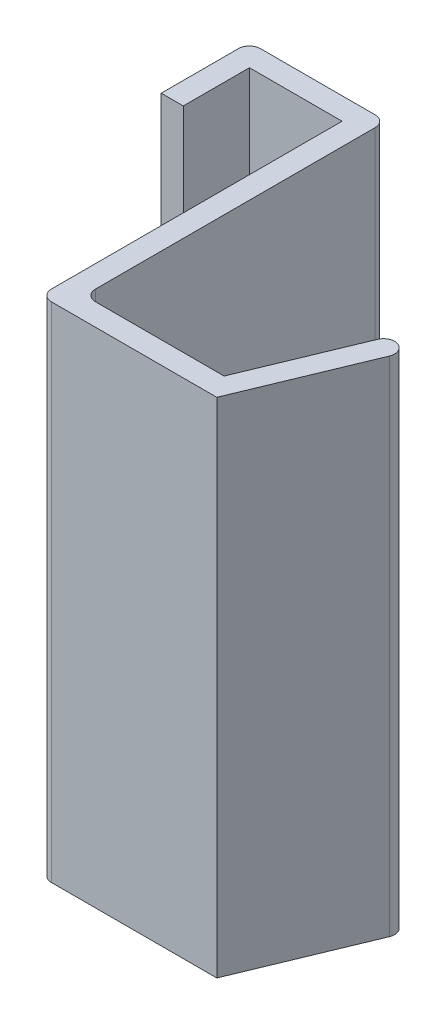
from build123d import *

# Parameters (mm, degrees)
EXTRUDE_1_DEPTH = 114
FILLET_5_R      = 2.5
FILLET_6_R      = 2.5
FILLET_8_R      = 2.5
FILLET_10_R     = 2.5
FILLET_11_R     = 2.5


with BuildPart() as part:
    # ｽｹｯﾁ1 → ﾎﾞｽ - 押し出し1 (new body)
    with BuildSketch(Plane(origin=(0, 0, 0), x_dir=(1, 0, 0), z_dir=(0, 1, 0))):
        Polygon((47.807009209, -4.786582838), (36.65910681, -31.7), (5, -31.7), (5, 36.7), (-26, 36.7), (-26, 16.7), (-21, 16.7), (-21, 31.7), (0, 31.7), (0, -36.7), (40, -36.7), (52.426406871, -6.7), align=None)
    extrude(amount=EXTRUDE_1_DEPTH)

    # ﾌｨﾚｯﾄ5
    fillet_5_edges = [part.edges().sort_by_distance(p)[0] for p in [
        (-26, 57, -36.7),
    ]]
    fillet(fillet_5_edges, radius=FILLET_5_R)

    # ﾌｨﾚｯﾄ6
    fillet_6_edges = [part.edges().sort_by_distance(p)[0] for p in [
        (5, 57, -36.7),
    ]]
    fillet(fillet_6_edges, radius=FILLET_6_R)

    # ﾌｨﾚｯﾄ8
    fillet_8_edges = [part.edges().sort_by_distance(p)[0] for p in [
        (52.426406871, 57, 6.7),
        (47.807009209, 57, 4.786582838),
    ]]
    fillet(fillet_8_edges, radius=FILLET_8_R - 0.0001)  # a hair under: the kernel refuses the full size

    # ﾌｨﾚｯﾄ10
    fillet_10_edges = [part.edges().sort_by_distance(p)[0] for p in [
        (0, 57, 36.7),
    ]]
    fillet(fillet_10_edges, radius=FILLET_10_R)

    # ﾌｨﾚｯﾄ11
    fillet_11_edges = [part.edges().sort_by_distance(p)[0] for p in [
        (5, 57, 31.7),
    ]]
    fillet(fillet_11_edges, radius=FILLET_11_R)


solid = part.part
